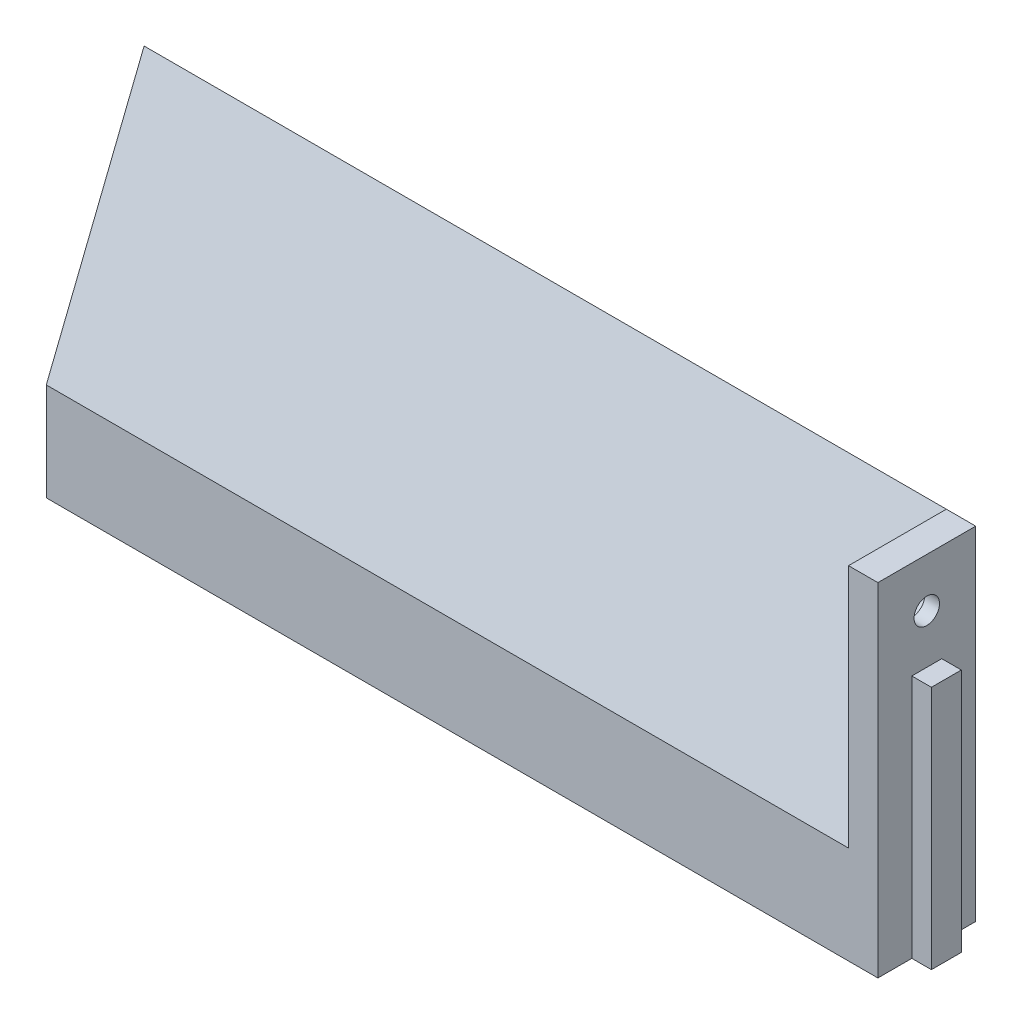
from build123d import *

# Parameters (mm, degrees)
SKETCH_1_W          = 170
SKETCH_1_H          = 20
EXTRUDE_1_DEPTH     = 70
CUT_EXTRUDE_1_DEPTH = 164
CUT_EXTRUDE_2_DEPTH = 3
SKETCH_4_R          = 2.6
CUT_EXTRUDE_3_DEPTH = 3
SKETCH_5_W          = 6.12
SKETCH_5_H          = 50
EXTRUDE_2_DEPTH     = 4
CUT_EXTRUDE_4_DEPTH = 200


with BuildPart() as part:
    # 草图1 → 凸台-拉伸1 (new body)
    with BuildSketch(Plane(origin=(0, 0, 0), x_dir=(1, 0, 0), z_dir=(0, 1, 0))):
        with Locations((85, 10)):
            Rectangle(SKETCH_1_W, SKETCH_1_H)
    extrude_1 = extrude(amount=EXTRUDE_1_DEPTH)

    # 草图2 → 切除-拉伸1 (cut)
    with BuildSketch(Plane(origin=(170, 0, 0), x_dir=(0, 0, -1), z_dir=(1, 0, 0))):
        Polygon((0, 70), (0, 20), (20, 70), align=None)
    cut_extrude_1 = extrude(amount=-CUT_EXTRUDE_1_DEPTH, mode=Mode.SUBTRACT)

    # 草图3 → 切除-拉伸2 (cut)
    with BuildSketch(Plane(origin=(6, 0, 0), x_dir=(0, 0, -1), z_dir=(1, 0, 0))):
        with BuildLine():
            ThreePointArc((10, 65), (6.464466094, 56.464466094), (15, 60))
            ThreePointArc((15, 60), (13.535533906, 63.535533906), (10, 65))
        make_face()
    cut_extrude_2 = extrude(amount=-CUT_EXTRUDE_2_DEPTH, mode=Mode.SUBTRACT)

    # 草图4 → 切除-拉伸3 (cut)
    with BuildSketch(Plane(origin=(3, 0, 0), x_dir=(0, 0, -1), z_dir=(1, 0, 0))):
        with Locations((10, 60)):
            Circle(SKETCH_4_R)
    cut_extrude_3 = extrude(amount=-CUT_EXTRUDE_3_DEPTH, mode=Mode.SUBTRACT)

    # 草图5 → 凸台-拉伸2 (add)
    with BuildSketch(Plane.ZY):
        with Locations((-10, 25)):
            Rectangle(SKETCH_5_W, SKETCH_5_H)
    extrude_2 = extrude(amount=EXTRUDE_2_DEPTH)

    # 镜向1: 凸台-拉伸1, 切除-拉伸1, 切除-拉伸2, 切除-拉伸3, 凸台-拉伸2 across plane
    add(extrude_1.mirror(Plane(origin=(170, 70, 0), x_dir=(0, 0, 1), z_dir=(-1, 0, 0))))
    add(cut_extrude_1.mirror(Plane(origin=(170, 70, 0), x_dir=(0, 0, 1), z_dir=(-1, 0, 0))), mode=Mode.SUBTRACT)
    add(cut_extrude_2.mirror(Plane(origin=(170, 70, 0), x_dir=(0, 0, 1), z_dir=(-1, 0, 0))), mode=Mode.SUBTRACT)
    add(cut_extrude_3.mirror(Plane(origin=(170, 70, 0), x_dir=(0, 0, 1), z_dir=(-1, 0, 0))), mode=Mode.SUBTRACT)
    add(extrude_2.mirror(Plane(origin=(170, 70, 0), x_dir=(0, 0, 1), z_dir=(-1, 0, 0))))

    # 草图6 → 切除-拉伸4 (cut)
    with BuildSketch(Plane.XZ):
        Polygon((170, 0), (0, 0), (0, -6.94), (-4, -6.94), (-4, -13.06), (0, -13.06), (0, -20), (170, -20), align=None)
    extrude(amount=-CUT_EXTRUDE_4_DEPTH, mode=Mode.SUBTRACT)


solid = part.part
